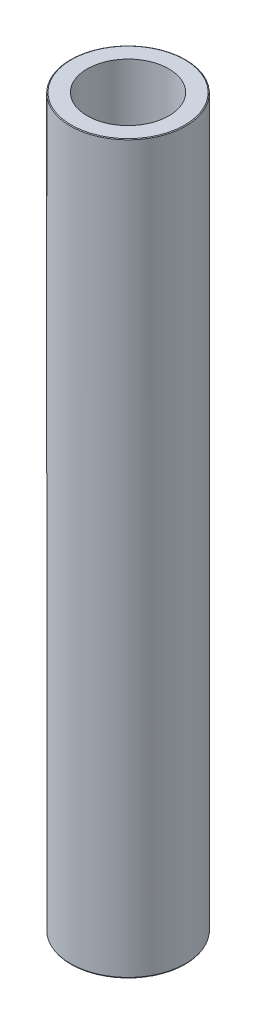
from build123d import *
from OCP.BRepFilletAPI import BRepFilletAPI_MakeChamfer

# Parameters (mm, degrees)
SKETCH1_R           = 47.5
BOSS_EXTRUDE1_DEPTH = 600
SKETCH2_R           = 33.67002774
CUT_EXTRUDE1_DEPTH  = 604.748706003
CHAMFER1_SIZE       = 0.40923484
CHAMFER1_SIZE2      = 0.708815536


with BuildPart() as part:
    # Sketch1 → Boss-Extrude1 (new body)
    with BuildSketch(Plane(origin=(0, 0, 0), x_dir=(1, 0, 0), z_dir=(0, 1, 0))):
        Circle(SKETCH1_R)
    extrude(amount=BOSS_EXTRUDE1_DEPTH)

    # Sketch2 → Cut-Extrude1 (cut, through all)
    with BuildSketch(Plane(origin=(0, 0, 0), x_dir=(1, 0, 0), z_dir=(0, 1, 0))):
        Circle(SKETCH2_R)
    extrude(amount=CUT_EXTRUDE1_DEPTH, mode=Mode.SUBTRACT)

    # Chamfer1: one chamfer whose edges measure the first distance from different faces: ONE call of the kernel's chamfer builder (chamfer() names one face for all edges)
    chamfer1_edges_1 = [part.edges().sort_by_distance(p)[0] for p in [
        (-47.5, 600, 0),
    ]]
    chamfer1_side_1 = [part.faces().sort_by_distance(p)[0] for p in [
        (-47.5, 300, 0),
    ]]
    chamfer1_edges_2 = [part.edges().sort_by_distance(p)[0] for p in [
        (-47.5, 0, 0),
    ]]
    chamfer1_side_2 = [part.faces().sort_by_distance(p)[0] for p in [
        (-46.156497116, 0, 0),
    ]]
    chamfer1 = BRepFilletAPI_MakeChamfer(part.part.solid().wrapped)
    for e in chamfer1_edges_1:
        chamfer1.Add(CHAMFER1_SIZE, CHAMFER1_SIZE2, e.wrapped, chamfer1_side_1[0].wrapped)  # the first distance lies on this face
    for e in chamfer1_edges_2:
        chamfer1.Add(CHAMFER1_SIZE, CHAMFER1_SIZE2, e.wrapped, chamfer1_side_2[0].wrapped)  # the first distance lies on this face
    add(Compound.cast(chamfer1.Shape()), mode=Mode.REPLACE)


solid = part.part
